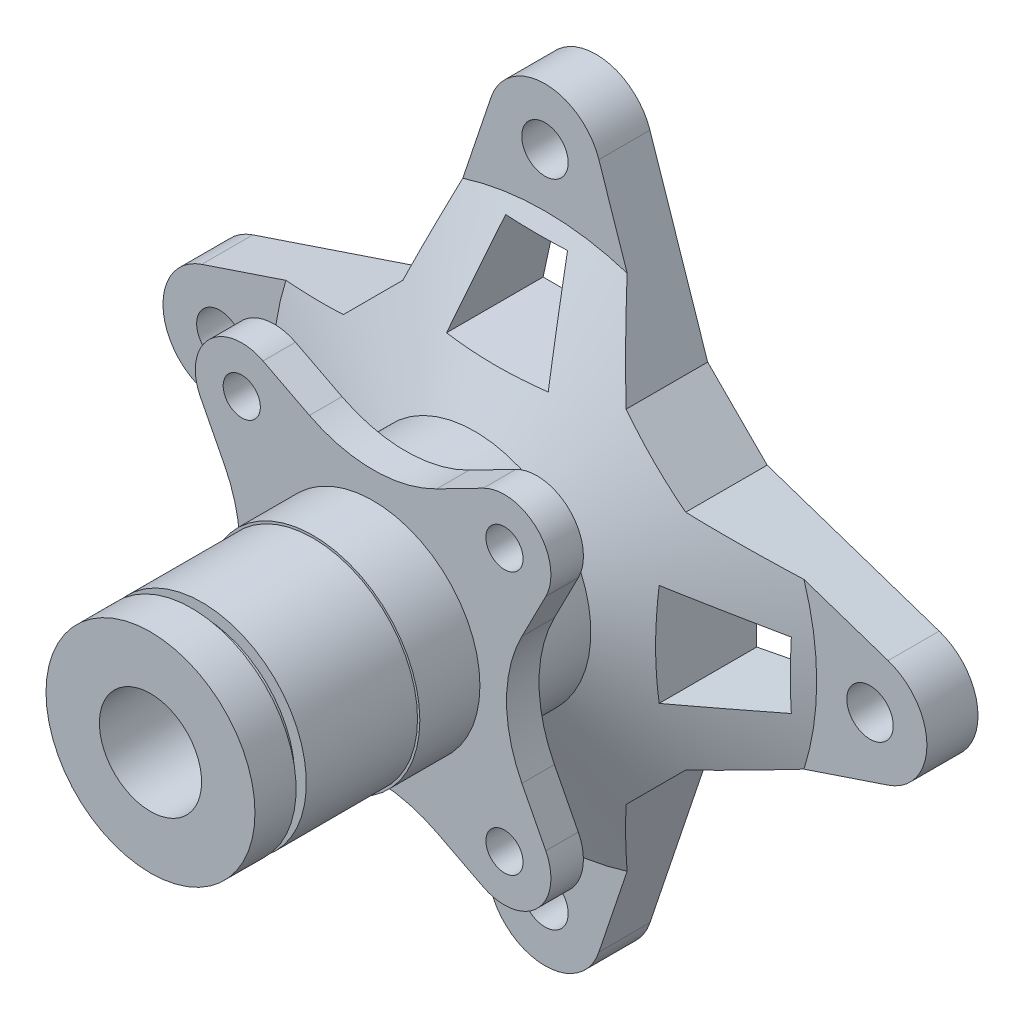
from build123d import *

# Parameters (mm, degrees)
SKETCH1_R           = 12.25
SKETCH1_R_2         = 5
SKETCH1_R_3         = 18.5
BOSS_EXTRUDE1_DEPTH = 11
CUT_EXTRUDE1_DEPTH  = 146.445288411
SKETCH6_R           = 25
SKETCH6_R_2         = 18.5
BOSS_EXTRUDE2_DEPTH = 37
BOSS_EXTRUDE3_START = -7
SKETCH7_R           = 10
SKETCH7_R_2         = 4
BOSS_EXTRUDE3_DEPTH = 7
SKETCH8_R           = 23
SKETCH8_R_2         = 18.5
BOSS_EXTRUDE4_DEPTH = 12.94
BOSS_EXTRUDE5_START = -9
SKETCH9_R           = 22.5
SKETCH9_R_2         = 11
BOSS_EXTRUDE5_DEPTH = 44
FILLET1_R           = 30
FILLET2_R           = 30
FILLET3_R           = 30
FILLET4_R           = 30
CUT_EXTRUDE2_START  = 2.2
SKETCH11_R          = 22.5
SKETCH11_R_2        = 20
CUT_EXTRUDE2_DEPTH  = 2.2


with BuildPart() as part:
    # Sketch1 → Boss-Extrude1 (new body)
    # profile 1 of 9: a face of its own
    with BuildSketch(Plane.XY):
        with BuildLine():
            ThreePointArc((-36.85163056, 10.786147217), (-46.81, 34.827777778), (-36.85163056, 58.869408338))
            Line((-36.85163056, 58.869408338), (-73.896232739, 46.441643217))
            ThreePointArc((-73.896232739, 46.441643217), (-62.846901058, 44.772408265), (-57.75, 34.827777778))
            ThreePointArc((-57.75, 34.827777778), (-62.846901058, 24.88314729), (-73.896232739, 23.213912339))
            Line((-73.896232739, 23.213912339), (-36.85163056, 10.786147217))
        make_face()
    # profile 2 of 9: a face of its own
    with BuildSketch(Plane.XY):
        with Locations((-70, 34.827777778)):
            Circle(SKETCH1_R)
        with Locations((-70, 34.827777778)):
            Circle(SKETCH1_R_2, mode=Mode.SUBTRACT)
    # profile 3 of 9: a face of its own
    with BuildSketch(Plane.XY):
        with BuildLine():
            Line((24.04163056, 71.679408338), (36.85163056, 58.869408338))
            ThreePointArc((36.85163056, 58.869408338), (46.81, 34.827777778), (36.85163056, 10.786147217))
            Line((36.85163056, 10.786147217), (24.04163056, -2.023852783))
            ThreePointArc((24.04163056, -2.023852783), (0, -11.982222222), (-24.04163056, -2.023852783))
            Line((-24.04163056, -2.023852783), (-36.85163056, 10.786147217))
            ThreePointArc((-36.85163056, 10.786147217), (-46.81, 34.827777778), (-36.85163056, 58.869408338))
            Line((-36.85163056, 58.869408338), (-24.04163056, 71.679408338))
            ThreePointArc((-24.04163056, 71.679408338), (0, 81.637777778), (24.04163056, 71.679408338))
        make_face()
        with Locations((0, 34.827777778)):
            Circle(SKETCH1_R_3, mode=Mode.SUBTRACT)
    # profile 4 of 9: a face of its own
    with BuildSketch(Plane.XY):
        with BuildLine():
            Line((-11.613865439, 108.724010517), (-24.04163056, 71.679408338))
            ThreePointArc((-24.04163056, 71.679408338), (0, 81.637777778), (24.04163056, 71.679408338))
            Line((24.04163056, 71.679408338), (11.613865439, 108.724010517))
            ThreePointArc((11.613865439, 108.724010517), (12.089920422, 106.801688663), (12.25, 104.827777778))
            ThreePointArc((12.25, 104.827777778), (-1.973910886, 92.737857356), (-11.613865439, 108.724010517))
        make_face()
    # profile 5 of 9: a face of its own
    with BuildSketch(Plane.XY):
        with Locations((0, 104.827777778)):
            Circle(SKETCH1_R)
        with Locations((0, 104.827777778)):
            Circle(SKETCH1_R_2, mode=Mode.SUBTRACT)
    # profile 6 of 9: a face of its own
    with BuildSketch(Plane.XY):
        with BuildLine():
            Line((73.896232739, 46.441643217), (36.85163056, 58.869408338))
            ThreePointArc((36.85163056, 58.869408338), (46.81, 34.827777778), (36.85163056, 10.786147217))
            Line((36.85163056, 10.786147217), (73.896232739, 23.213912339))
            ThreePointArc((73.896232739, 23.213912339), (57.75, 34.827777778), (73.896232739, 46.441643217))
        make_face()
    # profile 7 of 9: a face of its own
    with BuildSketch(Plane.XY):
        with Locations((70, 34.827777778)):
            Circle(SKETCH1_R)
        with Locations((70, 34.827777778)):
            Circle(SKETCH1_R_2, mode=Mode.SUBTRACT)
    # profile 8 of 9: a face of its own
    with BuildSketch(Plane.XY):
        with BuildLine():
            ThreePointArc((24.04163056, -2.023852783), (0, -11.982222222), (-24.04163056, -2.023852783))
            Line((-24.04163056, -2.023852783), (-11.613865439, -39.068454962))
            ThreePointArc((-11.613865439, -39.068454962), (-1.973910886, -23.0823018), (12.25, -35.172222222))
            ThreePointArc((12.25, -35.172222222), (12.089920422, -37.146133108), (11.613865439, -39.068454962))
            Line((11.613865439, -39.068454962), (24.04163056, -2.023852783))
        make_face()
    # profile 9 of 9: a face of its own
    with BuildSketch(Plane.XY):
        with Locations((0, -35.172222222)):
            Circle(SKETCH1_R)
        with Locations((0, -35.172222222)):
            Circle(SKETCH1_R_2, mode=Mode.SUBTRACT)
    extrude(amount=BOSS_EXTRUDE1_DEPTH)

    # Sketch4 → Revolve1 (revolve)
    with BuildSketch(Plane(origin=(17.413888889, 17.413888889, 0), x_dir=(-0.7071067811865475, 0.7071067811865477, 0), z_dir=(-0.7071067811865477, -0.7071067811865475, 0)), mode=Mode.PRIVATE) as revolve1_sk:
        Polygon((-33.88936916, -11), (-0.37304216, -11), (-0.37304216, -26.116343), align=None)
    revolve(revolve1_sk.sketch.rotate(Axis((0, 34.827777778, 11), (0, 0, 1)), 225), axis=Axis((0, 34.827777778, 11), (0, 0, 1)))

    # Sketch5 → Cut-Extrude1 (cut, through all)
    with BuildSketch(Plane(origin=(0, 0, 0), x_dir=(-1, 0, 0), z_dir=(0, 0, -1))):
        with BuildLine():
            ThreePointArc((-17.692319823, 90.605392865), (-41.377291632, 76.20506941), (-55.777615088, 52.5200976))
            Line((-55.777615088, 52.5200976), (-36.85163056, 58.869408338))
            Line((-36.85163056, 58.869408338), (-24.04163056, 71.679408338))
            Line((-24.04163056, 71.679408338), (-17.692319823, 90.605392865))
        make_face()
        with BuildLine():
            ThreePointArc((55.777615088, 52.5200976), (41.377291632, 76.20506941), (17.692319823, 90.605392865))
            Line((17.692319823, 90.605392865), (24.04163056, 71.679408338))
            Line((24.04163056, 71.679408338), (36.85163056, 58.869408338))
            Line((36.85163056, 58.869408338), (55.37393165, 52.655525778))
            Line((55.37393165, 52.655525778), (55.777615088, 52.5200976))
        make_face()
        with BuildLine():
            Line((24.04163056, -2.023852783), (17.692319823, -20.94983731))
            ThreePointArc((17.692319823, -20.94983731), (41.377291632, -6.549513854), (55.777615088, 17.135457955))
            Line((55.777615088, 17.135457955), (36.85163056, 10.786147217))
            Line((36.85163056, 10.786147217), (24.04163056, -2.023852783))
        make_face()
        Polygon((35.392942676, 45.82777736), (55.392942676, 41.94849234), (55.392942676, 27.70706238), (35.392942676, 23.82777736), align=None)
        Polygon((-10.607057324, 69.82777736), (11.392942676, 69.82777736), (7.078774717, 89.82777736), (-6.292889365, 89.82777736), align=None)
        Polygon((-34.607057324, 23.82777736), (-34.607057324, 45.82777736), (-54.607057324, 41.94849234), (-54.607057324, 27.70706238), align=None)
        Polygon((11.392942676, -0.17222264), (7.078774717, -20.17222264), (-6.292889365, -20.17222264), (-10.607057324, -0.17222264), align=None)
        with BuildLine():
            Line((-55.37393165, 17.000029778), (-55.777615088, 17.135457955))
            ThreePointArc((-55.777615088, 17.135457955), (-41.377291632, -6.549513854), (-17.692319823, -20.94983731))
            Line((-17.692319823, -20.94983731), (-24.04163056, -2.023852783))
            Line((-24.04163056, -2.023852783), (-36.85163056, 10.786147217))
            Line((-36.85163056, 10.786147217), (-55.37393165, 17.000029778))
        make_face()
    extrude(amount=-CUT_EXTRUDE1_DEPTH, mode=Mode.SUBTRACT)

    # Sketch6 → Boss-Extrude2 (add)
    with BuildSketch(Plane.XY.offset(11)):
        with Locations(Location((0, 34.827777778, 0), (0, 0, 180))):
            Circle(SKETCH6_R)
        with Locations((0, 34.827777778)):
            Circle(SKETCH6_R_2, mode=Mode.SUBTRACT)
    extrude(amount=BOSS_EXTRUDE2_DEPTH)

    # Sketch7 → Boss-Extrude3 (add)
    # profile 1 of 8: a face of its own
    with BuildSketch(Plane.XY.offset(48).offset(BOSS_EXTRUDE3_START)):
        with Locations((-28.284271247, 63.112049025)):
            Circle(SKETCH7_R)
        with Locations((-28.284271247, 63.112049025)):
            Circle(SKETCH7_R_2, mode=Mode.SUBTRACT)
    # profile 2 of 8: a face of its own
    with BuildSketch(Plane.XY.offset(48).offset(BOSS_EXTRUDE3_START)):
        with BuildLine():
            Line((-37.179737224, 58.543604535), (-25, 34.827777778))
            ThreePointArc((-25, 34.827777778), (-17.67766953, 52.505447307), (0, 59.827777778))
            Line((0, 59.827777778), (-23.715826757, 72.007515002))
            ThreePointArc((-23.715826757, 72.007515002), (-19.749505729, 68.323361485), (-18.284271247, 63.112049025))
            ThreePointArc((-18.284271247, 63.112049025), (-25.934235053, 53.392104073), (-37.179737224, 58.543604535))
        make_face()
    # profile 3 of 8: a face of its own
    with BuildSketch(Plane.XY.offset(48).offset(BOSS_EXTRUDE3_START)):
        with BuildLine():
            Line((-25, 34.827777778), (-37.179737224, 11.111951021))
            ThreePointArc((-37.179737224, 11.111951021), (-25.934235053, 16.263451483), (-18.284271247, 6.54350653))
            ThreePointArc((-18.284271247, 6.54350653), (-19.749505729, 1.332194071), (-23.715826757, -2.351959446))
            Line((-23.715826757, -2.351959446), (0, 9.827777778))
            ThreePointArc((0, 9.827777778), (-17.67766953, 17.150108248), (-25, 34.827777778))
        make_face()
    # profile 4 of 8: a face of its own
    with BuildSketch(Plane.XY.offset(48).offset(BOSS_EXTRUDE3_START)):
        with Locations((-28.284271247, 6.54350653)):
            Circle(SKETCH7_R)
        with Locations((-28.284271247, 6.54350653)):
            Circle(SKETCH7_R_2, mode=Mode.SUBTRACT)
    # profile 5 of 8: a face of its own
    with BuildSketch(Plane.XY.offset(48).offset(BOSS_EXTRUDE3_START)):
        with BuildLine():
            ThreePointArc((25, 34.827777778), (17.67766953, 17.150108248), (0, 9.827777778))
            Line((0, 9.827777778), (23.715826757, -2.351959446))
            ThreePointArc((23.715826757, -2.351959446), (21.213203436, 13.614574342), (37.179737224, 11.111951021))
            Line((37.179737224, 11.111951021), (25, 34.827777778))
        make_face()
    # profile 6 of 8: a face of its own
    with BuildSketch(Plane.XY.offset(48).offset(BOSS_EXTRUDE3_START)):
        with Locations((28.284271247, 6.54350653)):
            Circle(SKETCH7_R)
        with Locations((28.284271247, 6.54350653)):
            Circle(SKETCH7_R_2, mode=Mode.SUBTRACT)
    # profile 7 of 8: a face of its own
    with BuildSketch(Plane.XY.offset(48).offset(BOSS_EXTRUDE3_START)):
        with BuildLine():
            Line((23.715826757, 72.007515002), (0, 59.827777778))
            ThreePointArc((0, 59.827777778), (17.67766953, 52.505447307), (25, 34.827777778))
            Line((25, 34.827777778), (37.179737224, 58.543604535))
            ThreePointArc((37.179737224, 58.543604535), (21.213203436, 56.040981213), (23.715826757, 72.007515002))
        make_face()
    # profile 8 of 8: a face of its own
    with BuildSketch(Plane.XY.offset(48).offset(BOSS_EXTRUDE3_START)):
        with Locations((28.284271247, 63.112049025)):
            Circle(SKETCH7_R)
        with Locations((28.284271247, 63.112049025)):
            Circle(SKETCH7_R_2, mode=Mode.SUBTRACT)
    extrude(amount=BOSS_EXTRUDE3_DEPTH)

    # Sketch8 → Boss-Extrude4 (add)
    with BuildSketch(Plane.XY.offset(48)):
        with Locations((0, 34.827777778)):
            Circle(SKETCH8_R)
        with Locations((0, 34.827777778)):
            Circle(SKETCH8_R_2, mode=Mode.SUBTRACT)
    extrude(amount=BOSS_EXTRUDE4_DEPTH)

    # Sketch9 → Boss-Extrude5 (add)
    with BuildSketch(Plane.XY.offset(60.94).offset(BOSS_EXTRUDE5_START)):
        with Locations((0, 34.827777778)):
            Circle(SKETCH9_R)
        with Locations((0, 34.827777778)):
            Circle(SKETCH9_R_2, mode=Mode.SUBTRACT)
    extrude(amount=BOSS_EXTRUDE5_DEPTH)

    # Fillet1
    fillet1_edges = [part.edges().sort_by_distance(p)[0] for p in [
        (25, 34.827777778, 44.5),
    ]]
    fillet(fillet1_edges, radius=FILLET1_R)

    # Fillet2
    fillet2_edges = [part.edges().sort_by_distance(p)[0] for p in [
        (0, 9.827777778, 44.5),
    ]]
    fillet(fillet2_edges, radius=FILLET2_R)

    # Fillet3
    # the kernel refuses this fillet: 30 mm, written as the material it adds along each edge
    with BuildSketch(Plane(origin=(-25, 34.827777778, 41), x_dir=(-0.456844449019231, -0.8895465976554097, 0), z_dir=(0, 0, 1))) as fillet3_piece_1:
        with BuildLine():
            CenterArc((FILLET3_R * 0.513570003217, -FILLET3_R), FILLET3_R, 90, 54.367344522)
            Line((-FILLET3_R * 0.299198847349, -FILLET3_R * 0.417413701199), (0, 0))
            Line((0, 0), (FILLET3_R * 0.513570003217, 0))
        make_face()
    extrude(amount=7)

    # Fillet4
    fillet4_edges = [part.edges().sort_by_distance(p)[0] for p in [
        (0, 59.827777778, 44.5),
    ]]
    fillet(fillet4_edges, radius=FILLET4_R)

    # Sketch11 → Cut-Extrude2 (cut)
    with BuildSketch(Plane(origin=(0, 0, 87.08), x_dir=(-1, 0, 0), z_dir=(0, 0, -1)).offset(CUT_EXTRUDE2_START)):
        with Locations((0, 34.827777778)):
            Circle(SKETCH11_R)
        with Locations((0, 34.827777778)):
            Circle(SKETCH11_R_2, mode=Mode.SUBTRACT)
    extrude(amount=-CUT_EXTRUDE2_DEPTH, mode=Mode.SUBTRACT)


solid = part.part
